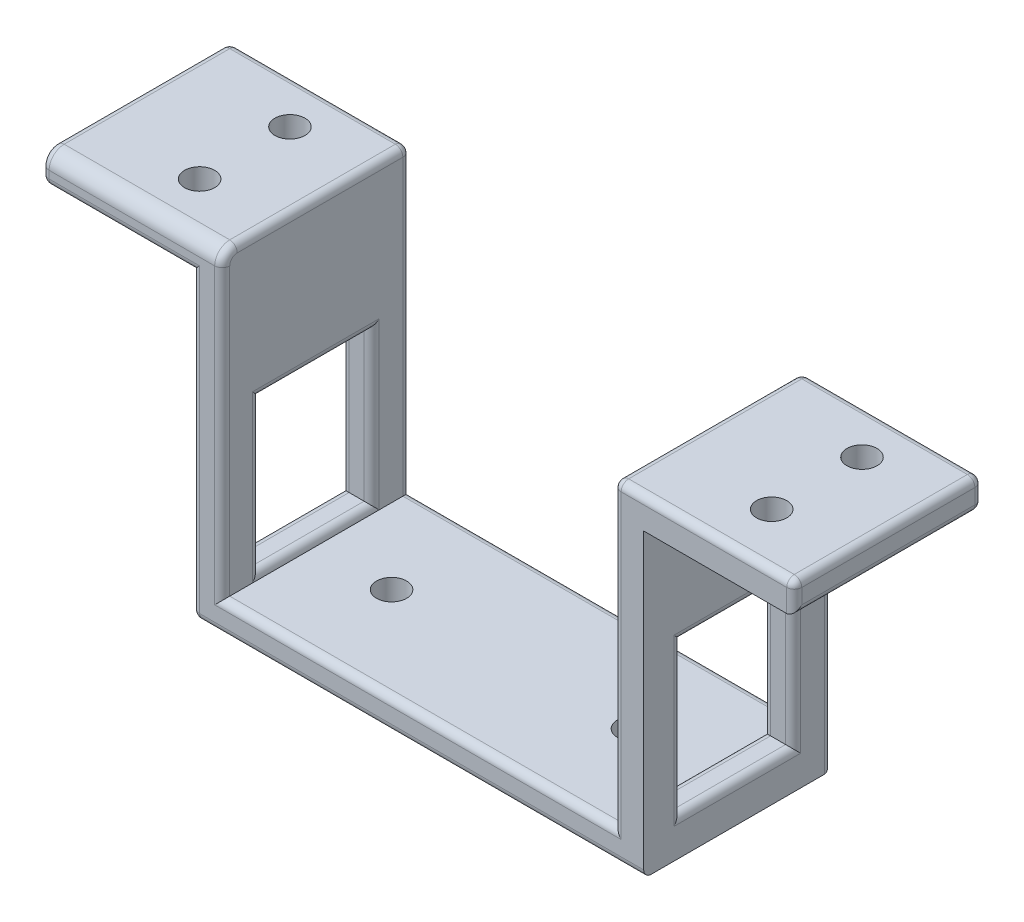
from build123d import *

# Parameters (mm, degrees)
BOSS_EXTRUDE1_DEPTH = 4
BOSS_EXTRUDE2_DEPTH = 40
SKETCH3_W           = 25
SKETCH3_H           = 4.000000000000007
BOSS_EXTRUDE3_DEPTH = 20
BOSS_EXTRUDE4_DEPTH = 20
SKETCH5_R           = 2.0000000000000004
SKETCH5_R_2         = 2.0000000000000018
SKETCH5_R_3         = 1.9999999999999967
CUT_EXTRUDE1_DEPTH  = 20
CUT_EXTRUDE3_DEPTH  = 75.00000000000004
SKETCH11_R          = 2.0000000000000027
CUT_EXTRUDE4_DEPTH  = 75.00000000000004
FILLET1_R           = 2
FILLET2_R           = 1
FILLET3_R           = 1
FILLET4_R           = 1
FILLET5_R           = 1
FILLET6_R           = 1
FILLET7_R           = 1
FILLET8_R           = 1
FILLET9_R           = 1
FILLET10_R          = 1
FILLET11_R          = 1
FILLET12_R          = 1
FILLET13_R          = 1
FILLET14_R          = 1
FILLET15_R          = 1
FILLET16_R          = 1
FILLET17_R          = 1
FILLET18_R          = 1
FILLET19_R          = 1
FILLET20_R          = 1
FILLET21_R          = 1


# Some blends are built 0.0001 mm under size
with BuildPart() as part:
    # Sketch1 → Boss-Extrude1 (new body)
    with BuildSketch(Plane(origin=(0, 0, 0), x_dir=(1, 0, 0), z_dir=(0, 1, 0))):
        Polygon((0, 0), (60, 0), (60.00000000000001, -25), (6.94e-15, -25), align=None)
    extrude(amount=BOSS_EXTRUDE1_DEPTH)

    # Sketch2 → Boss-Extrude2 (add)
    with BuildSketch(Plane(origin=(0, 4, 0), x_dir=(1, 0, 0), z_dir=(0, 1, 0))):
        Polygon((0, 0), (4, 0), (4.0000000000000036, -25), (0, -25), align=None)
        Polygon((60, 0), (55.99999999999999, -4.9e-16), (55.99999999999999, -25), (60, -25), align=None)
    extrude(amount=BOSS_EXTRUDE2_DEPTH)

    # Sketch3 → Boss-Extrude3 (add)
    with BuildSketch(Plane(origin=(60, 0, -1.665e-14), x_dir=(-2.8e-16, 0, -1), z_dir=(1, 0, -2.8e-16))):
        with Locations((-12.500000000000018, 42)):
            Rectangle(SKETCH3_W, SKETCH3_H)
    extrude(amount=BOSS_EXTRUDE3_DEPTH)

    # Sketch4 → Boss-Extrude4 (add)
    with BuildSketch(Plane.ZY):
        Polygon((0, 44), (25, 44), (25, 39.99999999999999), (4.9e-16, 39.99999999999999), align=None)
    extrude(amount=BOSS_EXTRUDE4_DEPTH)

    # Sketch5 → Cut-Extrude1 (cut)
    with BuildSketch(Plane(origin=(0, 44, 0), x_dir=(1, 0, 0), z_dir=(0, 1, 0))):
        with Locations(Location((-5.999999999999995, -6.000000000000008, 0), (0, 0, 270))):
            Circle(SKETCH5_R)
        with Locations(Location((-5.9999999999999964, -18.00000000000001, 0), (0, 0, 270))):
            Circle(SKETCH5_R_2)
        with Locations(Location((69.99999999999999, -6.000000000000002, 0), (0, 0, 270))):
            Circle(SKETCH5_R_3)
        with Locations(Location((70, -18.000000000000004, 0), (0, 0, 270))):
            Circle(SKETCH5_R_3)
    extrude(amount=-CUT_EXTRUDE1_DEPTH, mode=Mode.SUBTRACT)

    # Sketch10 → Cut-Extrude3 (cut)
    with BuildSketch(Plane.ZY):
        Polygon((5.148891761902153, 25), (20, 25.000000000000004), (20.000000000000004, 5.0000000000000036), (5.148891761902154, 5.000000000000001), align=None)
    extrude(amount=-CUT_EXTRUDE3_DEPTH, mode=Mode.SUBTRACT)

    # Sketch11 → Cut-Extrude4 (cut)
    with BuildSketch(Plane(origin=(0, 4, 0), x_dir=(1, 0, 0), z_dir=(0, 1, 0))):
        with Locations(Location((14.000000000000005, -12.5, 0), (0, 0, 270))):
            Circle(SKETCH11_R)
        with Locations(Location((45.99999999999999, -12.5, 0), (0, 0, 270))):
            Circle(SKETCH11_R)
    extrude(amount=-CUT_EXTRUDE4_DEPTH, mode=Mode.SUBTRACT)

    # Fillet1
    fillet1_edges = [part.edges().sort_by_distance(p)[0] for p in [
        (-7.999999999999995, 44, 25.000000000000004),
    ]]
    fillet(fillet1_edges, radius=FILLET1_R)

    # Fillet2
    fillet2_edges = [part.edges().sort_by_distance(p)[0] for p in [
        (-19.999999999999996, 44, 11.500000000000002),
        (4.000000000000002, 44, 11.499999999999996),
        (4.0000000000000036, 23, 25),
        (4.0000000000000036, 43.41421356237309, 24.41421356237309),
        (-19.999999999999993, 43.41421356237309, 24.414213562373096),
        (-19.999999999999993, 41, 25.000000000000007),
    ]]
    fillet(fillet2_edges, radius=FILLET2_R)

    # Fillet3
    fillet3_edges = [part.edges().sort_by_distance(p)[0] for p in [
        (68, 44, 25),
    ]]
    fillet(fillet3_edges, radius=FILLET3_R)

    # Fillet4
    fillet4_edges = [part.edges().sort_by_distance(p)[0] for p in [
        (55.99999999999999, 23.5, 25),
        (55.99999999999999, 43.707106781186546, 24.707106781186546),
        (55.99999999999999, 44, 12),
    ]]
    fillet(fillet4_edges, radius=FILLET4_R)

    # Fillet5
    fillet5_edges = [part.edges().sort_by_distance(p)[0] for p in [
        (30, 4, 25),
    ]]
    fillet(fillet5_edges, radius=FILLET5_R)

    # Fillet6
    fillet6_edges = [part.edges().sort_by_distance(p)[0] for p in [
        (3.49e-15, 5.000000000000002, 12.574445880951078),
    ]]
    fillet(fillet6_edges, radius=FILLET6_R)

    # Fillet7
    fillet7_edges = [part.edges().sort_by_distance(p)[0] for p in [
        (1.32e-15, 14.5, 5.148891761902153),
    ]]
    fillet(fillet7_edges, radius=FILLET7_R)

    # Fillet8
    fillet8_edges = [part.edges().sort_by_distance(p)[0] for p in [
        (3.33e-15, 25, 12.074445880951076),
    ]]
    fillet(fillet8_edges, radius=FILLET8_R)

    # Fillet9
    fillet9_edges = [part.edges().sort_by_distance(p)[0] for p in [
        (3.78e-15, 19.999999999999996, 25),
    ]]
    fillet(fillet9_edges, radius=FILLET9_R)

    # Fillet10
    fillet10_edges = [part.edges().sort_by_distance(p)[0] for p in [
        (55.99999999999999, 5.000000000000003, 12.574445880951062),
    ]]
    fillet(fillet10_edges, radius=FILLET10_R - 0.0001)  # a hair under: the kernel refuses the full size

    # Fillet11
    fillet11_edges = [part.edges().sort_by_distance(p)[0] for p in [
        (55.99999999999999, 14.500050000000002, 5.148891761902138),
    ]]
    fillet(fillet11_edges, radius=FILLET11_R)

    # Fillet12
    fillet12_edges = [part.edges().sort_by_distance(p)[0] for p in [
        (55.99999999999999, 25, 12.074445880951062),
    ]]
    fillet(fillet12_edges, radius=FILLET12_R)

    # Fillet13
    fillet13_edges = [part.edges().sort_by_distance(p)[0] for p in [
        (55.99999999999999, 15.000050000000003, 19.999999999999986),
    ]]
    fillet(fillet13_edges, radius=FILLET13_R)

    # Fillet14
    fillet14_edges = [part.edges().sort_by_distance(p)[0] for p in [
        (30.500000000000007, 0, 25),
        (0.2928932188134594, -1.1e-16, 24.707106781186546),
        (3.33e-15, 0, 12),
    ]]
    fillet(fillet14_edges, radius=FILLET14_R)

    # Fillet15
    fillet15_edges = [part.edges().sort_by_distance(p)[0] for p in [
        (29.999999999999996, 4, 0),
    ]]
    fillet(fillet15_edges, radius=FILLET15_R)

    # Fillet16
    fillet16_edges = [part.edges().sort_by_distance(p)[0] for p in [
        (0, 20.499999999999996, 0),
        (0.2928932188134523, 0.2928932188134522, 2e-16),
        (56.29289321881345, 43.707106781186546, 0),
        (30.5, 0, 0),
        (60, 19.999999999999996, 0),
        (80, 42, -5.55e-15),
        (70, 39.99999999999999, -2.78e-15),
        (68.5, 44, -2.66e-15),
        (55.99999999999999, 23, -1.1e-16),
    ]]
    fillet(fillet16_edges, radius=FILLET16_R)

    # Fillet17
    fillet17_edges = [part.edges().sort_by_distance(p)[0] for p in [
        (3.7071067811865475, 43.707106781186546, -1e-16),
        (-20, 41.5, 5.86e-15),
        (-19.707106781186546, 43.707106781186546, 2e-16),
        (4, 23, -1.1e-16),
        (-8, 44, 2.78e-15),
    ]]
    fillet(fillet17_edges, radius=FILLET17_R)

    # Fillet18
    fillet18_edges = [part.edges().sort_by_distance(p)[0] for p in [
        (-8.999999999999996, 39.99999999999999, 25),
        (-19.70710678118654, 39.99999999999999, 24.707106781186546),
        (-19.999999999999996, 39.99999999999999, 12.499999999999998),
        (-19.707106781186546, 39.99999999999999, 0.29289321881345254),
        (-9, 39.99999999999999, 2.99e-15),
    ]]
    fillet(fillet18_edges, radius=FILLET18_R)

    # Fillet19
    # the kernel refuses this fillet: 1 mm, written as the material it takes off along each edge
    with BuildSketch(Plane(origin=(79, 43, 1), x_dir=(1, 0, -2.8e-16), z_dir=(0, 1, 0))) as fillet19_piece_1_section:
        Polygon((0, 0), (FILLET19_R * 1.02, 0), (FILLET19_R * 1.02, FILLET19_R * 1.02), (2.8e-16, FILLET19_R * 1.02), align=None)
    fillet19_piece_1 = extrude(amount=FILLET19_R * 1.02, mode=Mode.PRIVATE)
    fillet19_piece_1 = fillet19_piece_1 - Plane(origin=(79, 43, 1), x_dir=(-0.7071067811865475, 0, 0.7071067811865477), z_dir=(0, 1, 0)) * Sphere(FILLET19_R, mode=Mode.PRIVATE)
    add(fillet19_piece_1, mode=Mode.SUBTRACT)
    with BuildSketch(Plane(origin=(79, 40.99999999999999, 1.0000000000000002), x_dir=(0, -1, 0), z_dir=(1, 0, -2.8e-16))) as fillet19_piece_2_section:
        Polygon((0, 0), (FILLET19_R * 1.02, 0), (FILLET19_R * 1.02, FILLET19_R * 1.02), (0, FILLET19_R * 1.02), align=None)
    fillet19_piece_2 = extrude(amount=FILLET19_R * 1.02, mode=Mode.PRIVATE)
    fillet19_piece_2 = fillet19_piece_2 - Plane(origin=(79, 40.99999999999999, 1.0000000000000002), x_dir=(0, 0.7071067811865475, 0.7071067811865475), z_dir=(1, 0, -2.8e-16)) * Sphere(FILLET19_R, mode=Mode.PRIVATE)
    add(fillet19_piece_2, mode=Mode.SUBTRACT)
    with BuildSketch(Plane(origin=(80, 37.49999999999999, 25), x_dir=(-1, 0, 0), z_dir=(0, 1, 0))) as fillet19_piece_3:
        with BuildLine():
            CenterArc((FILLET19_R, -FILLET19_R), FILLET19_R, 90, 90)
            Line((0, -FILLET19_R), (0, 0))
            Line((0, 0), (FILLET19_R, 0))
        make_face()
    extrude(amount=5.500000000000007, mode=Mode.SUBTRACT)
    with BuildSketch(Plane(origin=(80, 43, 23.999999999999996), x_dir=(0, 0, 1), z_dir=(0, -1, 0))) as fillet19_piece_4:
        with BuildLine():
            CenterArc((1 - FILLET19_R, FILLET19_R), FILLET19_R, 270, 90)
            Line((1 - FILLET19_R, 0), (1, 0))
            Line((1, 0), (1, FILLET19_R))
        make_face()
    revolve(axis=Axis((80, 43, 23.999999999999996), (-1, 0, 1.5e-16)), revolution_arc=90, mode=Mode.SUBTRACT)
    with BuildSketch(Plane(origin=(80, 44, 23.999999999999996), x_dir=(-1, 0, 2.8e-16), z_dir=(-2.8e-16, 0, -1))) as fillet19_piece_5:
        with BuildLine():
            CenterArc((FILLET19_R, -FILLET19_R), FILLET19_R, 90, 90)
            Line((0, -FILLET19_R), (0, 0))
            Line((0, 0), (FILLET19_R, 0))
        make_face()
    extrude(amount=22.999999999999996, mode=Mode.SUBTRACT)
    with BuildSketch(Plane(origin=(80, 39.99999999999999, 0.9999999999999998), x_dir=(0, 1, 0), z_dir=(2.8e-16, 0, 1))) as fillet19_piece_6:
        with BuildLine():
            CenterArc((FILLET19_R, FILLET19_R), FILLET19_R, 180, 90)
            Line((0, FILLET19_R), (0, 0))
            Line((0, 0), (FILLET19_R, 0))
        make_face()
    extrude(amount=26.499999999999996, mode=Mode.SUBTRACT)

    # Fillet20
    fillet20_edges = [part.edges().sort_by_distance(p)[0] for p in [
        (60, 15, 5.148891761902136),
        (60, 25.000000000000004, 12.57444588095106),
        (60.00000000000001, 15.000000000000004, 19.999999999999986),
        (60, 5.000000000000003, 12.574445880951062),
    ]]
    fillet(fillet20_edges, radius=FILLET20_R)

    # Fillet21
    fillet21_edges = [part.edges().sort_by_distance(p)[0] for p in [
        (4.000000000000001, 15, 5.148891761902152),
        (4.000000000000002, 25.000000000000004, 12.574445880951075),
        (4.000000000000003, 15.000000000000004, 20),
        (4.000000000000002, 5.000000000000003, 12.574445880951076),
    ]]
    fillet(fillet21_edges, radius=FILLET21_R - 0.0001)  # a hair under: the kernel refuses the full size


solid = part.part
